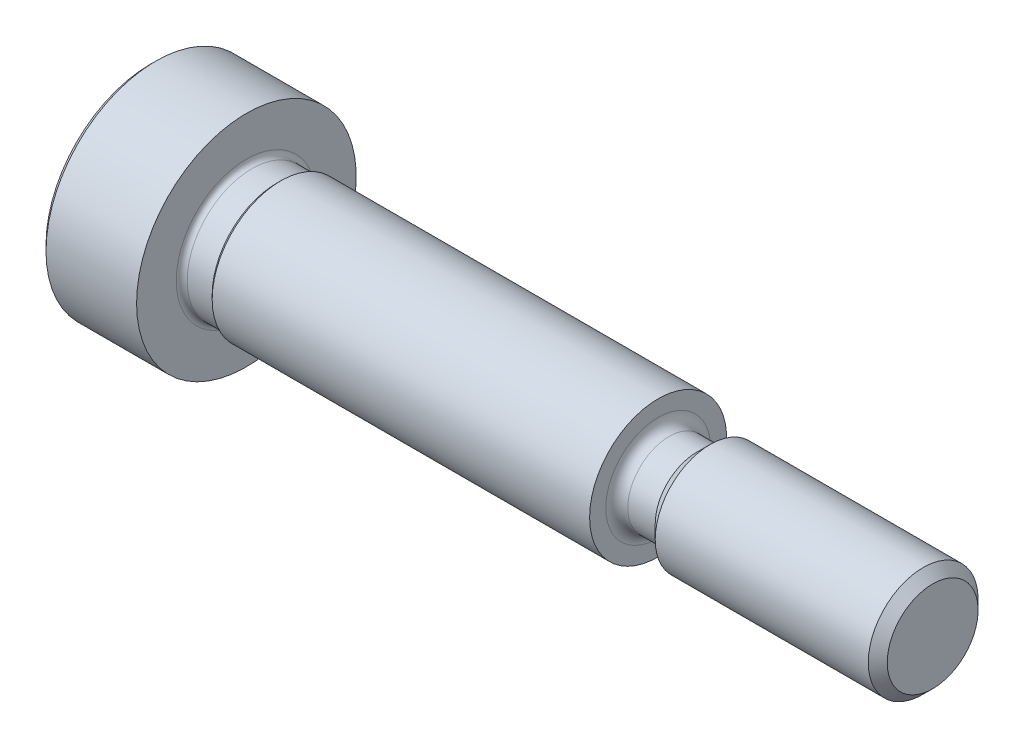
from build123d import *

# Parameters (mm, degrees)
CHAMFER1_SIZE = 0.4
HEX_2_DEPTH   = 4.2


# Read off the part's stored shape, not the designer's step: ThreadSchematic
with BuildPart() as part:
    # ThreadSchematic outline → ThreadSchematic (revolve)
    with BuildSketch(Plane.YX):
        with BuildLine():
            Line((0, 57), (0, 0))
            Line((0, 0), (8, 0))
            Line((8, 0), (8, 7))
            Line((8, 7), (5.11, 7))
            ThreePointArc((5.11, 7), (4.827157288, 7.117157288), (4.71, 7.4))
            Line((4.71, 7.4), (4.71, 9.2165))
            Line((4.71, 9.2165), (4.9935, 9.5))
            Line((4.9935, 9.5), (4.9935, 37))
            Line((4.9935, 37), (3.815, 37))
            ThreePointArc((3.815, 37), (3.249314575, 37.234314575), (3.015, 37.8))
            Line((3.015, 37.8), (3.015, 39.8))
            Line((3.015, 39.8), (4, 40.785))
            Line((4, 40.785), (4, 56.3095))
            Line((4, 56.3095), (3.3095, 57))
            Line((3.3095, 57), (0, 57))
        make_face()
    revolve(axis=Axis((0, 0, 0), (1, 0, 0)))

    # Chamfer1
    chamfer1_edges = [part.edges().sort_by_distance(p)[0] for p in [
        (0, -8, 0),
    ]]
    chamfer(chamfer1_edges, length=CHAMFER1_SIZE)

    # Sketch2 → PreBroach (revolve, cut)
    with BuildSketch(Plane.XY, mode=Mode.PRIVATE) as prebroach_sk:
        Polygon((0, 2.5475), (4.2, 2.5475), (5.670799811, 0), (0, 0), align=None)
    revolve(prebroach_sk.sketch.rotate(Axis((0, 0, 0), (1, 0, 0)), 90), axis=Axis((0, 0, 0), (1, 0, 0)), mode=Mode.SUBTRACT)

    # Sketch3 → Hex 2 (cut)
    with BuildSketch(Plane.ZY):
        Polygon((-2.5475, -1.470799811), (-2.5475, 1.470799811), (0, 2.941599622), (2.5475, 1.470799811), (2.5475, -1.470799811), (0, -2.941599622), align=None)
    extrude(amount=-HEX_2_DEPTH, mode=Mode.SUBTRACT)


solid = part.part
